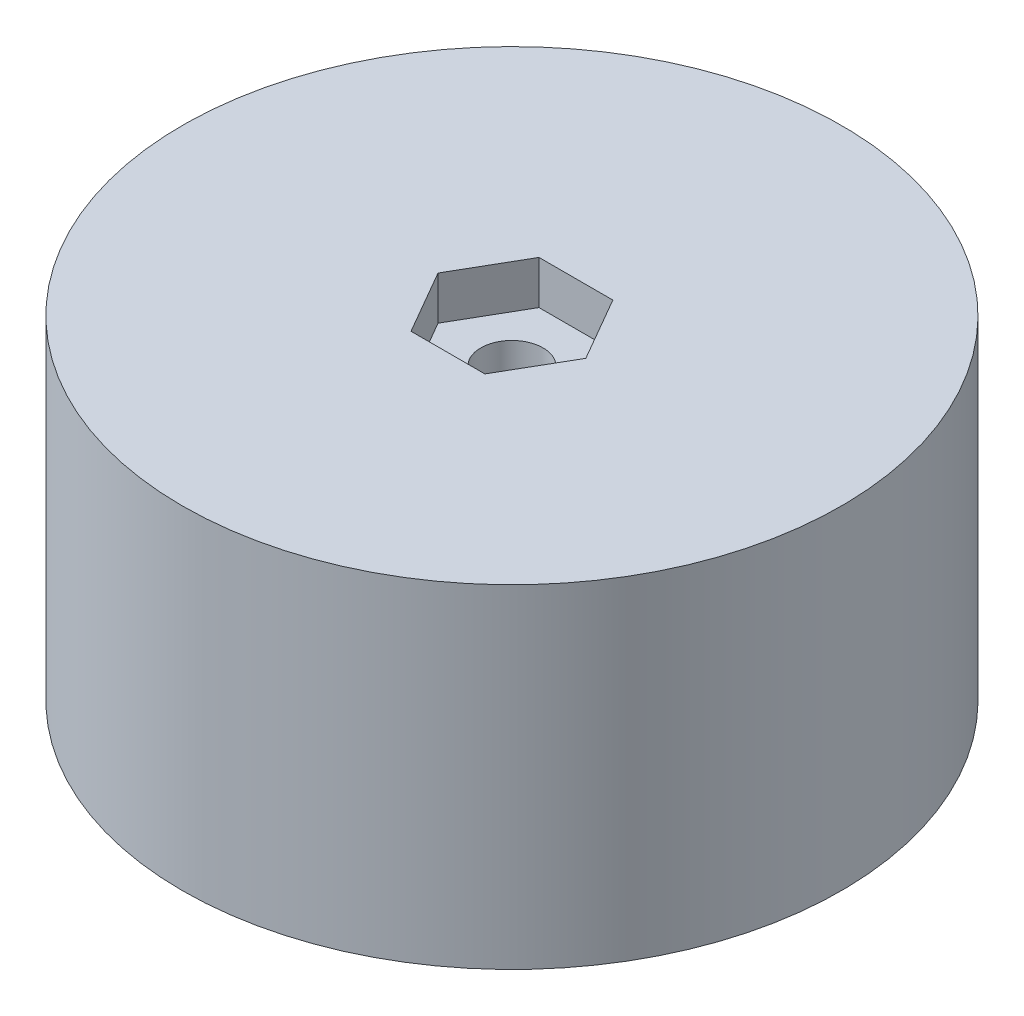
from build123d import *

# Parameters (mm, degrees)
SKETCH1_R           = 22.75
SKETCH1_R_2         = 2.15
BOSS_EXTRUDE1_DEPTH = 23
CUT_EXTRUDE1_DEPTH  = 3


with BuildPart() as part:
    # Sketch1 → Boss-Extrude1 (new body)
    with BuildSketch(Plane(origin=(0, 0, 0), x_dir=(1, 0, 0), z_dir=(0, 1, 0))):
        Circle(SKETCH1_R)
        Circle(SKETCH1_R_2, mode=Mode.SUBTRACT)
    extrude(amount=BOSS_EXTRUDE1_DEPTH)

    # Sketch2 → Cut-Extrude1 (cut)
    with BuildSketch(Plane(origin=(0, 23, 0), x_dir=(1, 0, 0), z_dir=(0, 1, 0))):
        Polygon((5.1, 0), (2.55, 4.416729559), (-2.55, 4.416729559), (-5.1, 0), (-2.55, -4.416729559), (2.55, -4.416729559), align=None)
    extrude(amount=-CUT_EXTRUDE1_DEPTH, mode=Mode.SUBTRACT)


solid = part.part
